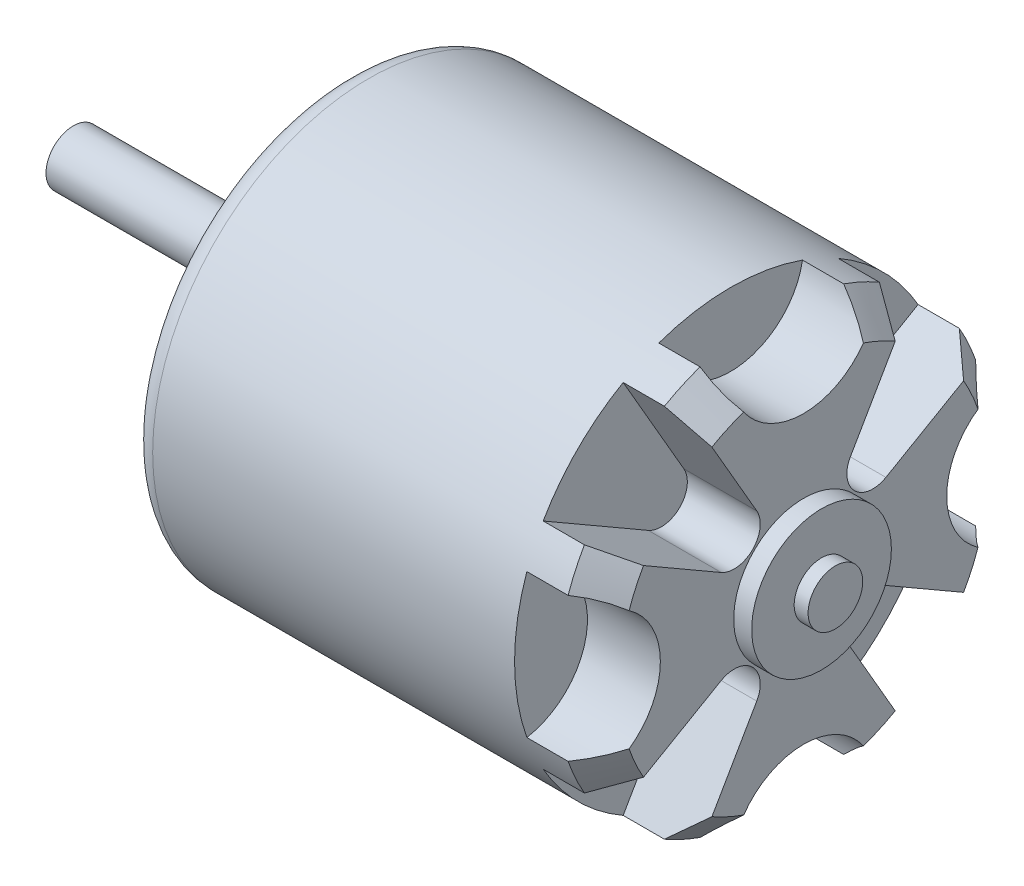
from build123d import *

# Parameters (mm, degrees)
SKETCH1_R                       = 31.623
BOSS_EXTRUDE1_DEPTH             = 66.802
CUT_EXTRUDE1_START              = -10.668
CUT_EXTRUDE1_DEPTH              = 10.668
CHAMFER1_SIZE                   = 4.6355
SKETCH3_R                       = 10.2235
BOSS_EXTRUDE2_DEPTH             = 2.6289
SKETCH4_R                       = 4
BOSS_EXTRUDE3_DEPTH             = 2.032
SKETCH5_R                       = 8.7376
BOSS_EXTRUDE4_DEPTH             = 12.3698
BOSS_EXTRUDE5_START             = 27.686
SKETCH6_R                       = 4
BOSS_EXTRUDE5_DEPTH             = 27.686
M4X0_7_TAPPED_HOLE1_D           = 3.3
M4X0_7_TAPPED_HOLE1_DEPTH       = 9.906
M4X0_7_TAPPED_HOLE1_CSINK_D     = 4.05
M4X0_7_TAPPED_HOLE1_CSINK_ANGLE = 90
M4X0_7_TAPPED_HOLE1_TIP         = 0.991420021
FILLET1_R                       = 3.175


with BuildPart() as part:
    # Sketch1 → Boss-Extrude1 (new body)
    with BuildSketch(Plane(origin=(0, 0, 0), x_dir=(0, 0, -1), z_dir=(1, 0, 0))):
        Circle(SKETCH1_R)
    extrude(amount=BOSS_EXTRUDE1_DEPTH)

    # Sketch2 → Cut-Extrude1 (cut)
    with BuildSketch(Plane(origin=(66.802, 0, 0), x_dir=(0, 0, -1), z_dir=(1, 0, 0)).offset(CUT_EXTRUDE1_START)):
        with BuildLine():
            Line((-27.43403991, 15.728559476), (-12.052689417, 6.848132628))
            ThreePointArc((-12.052689417, 6.848132628), (-7.45361258, 7.45361258), (-6.848132628, 12.052689417))
            Line((-6.848132628, 12.052689417), (-15.728559476, 27.43403991))
            ThreePointArc((-15.728559476, 27.43403991), (-22.360837741, 22.360837741), (-27.43403991, 15.728559476))
        make_face()
        with BuildLine():
            ThreePointArc((-29.823578313, -10.515146485), (-20.955, 0), (-29.823578313, 10.515146485))
            ThreePointArc((-29.823578313, 10.515146485), (-31.623, 0), (-29.823578313, -10.515146485))
        make_face()
        with BuildLine():
            ThreePointArc((6.848132628, 12.052689417), (7.45361258, 7.45361258), (12.052689417, 6.848132628))
            Line((12.052689417, 6.848132628), (27.43403991, 15.728559476))
            ThreePointArc((27.43403991, 15.728559476), (22.360837741, 22.360837741), (15.728559476, 27.43403991))
            Line((15.728559476, 27.43403991), (6.848132628, 12.052689417))
        make_face()
        with BuildLine():
            ThreePointArc((-6.848132628, -12.052689417), (-7.45361258, -7.45361258), (-12.052689417, -6.848132628))
            Line((-12.052689417, -6.848132628), (-27.43403991, -15.728559476))
            ThreePointArc((-27.43403991, -15.728559476), (-22.360837741, -22.360837741), (-15.728559476, -27.43403991))
            Line((-15.728559476, -27.43403991), (-6.848132628, -12.052689417))
        make_face()
        with BuildLine():
            ThreePointArc((10.515146485, 29.823578313), (0, 31.623), (-10.515146485, 29.823578313))
            ThreePointArc((-10.515146485, 29.823578313), (0, 20.955), (10.515146485, 29.823578313))
        make_face()
        with BuildLine():
            ThreePointArc((12.052689417, -6.848132628), (7.45361258, -7.45361258), (6.848132628, -12.052689417))
            Line((6.848132628, -12.052689417), (15.728559476, -27.43403991))
            ThreePointArc((15.728559476, -27.43403991), (22.360837741, -22.360837741), (27.43403991, -15.728559476))
            Line((27.43403991, -15.728559476), (12.052689417, -6.848132628))
        make_face()
        with BuildLine():
            ThreePointArc((29.823578313, -10.515146485), (31.623, 0), (29.823578313, 10.515146485))
            ThreePointArc((29.823578313, 10.515146485), (20.955, 0), (29.823578313, -10.515146485))
        make_face()
        with BuildLine():
            ThreePointArc((10.515146485, -29.823578313), (0, -20.955), (-10.515146485, -29.823578313))
            ThreePointArc((-10.515146485, -29.823578313), (0, -31.623), (10.515146485, -29.823578313))
        make_face()
    extrude(amount=CUT_EXTRUDE1_DEPTH, mode=Mode.SUBTRACT)

    # Chamfer1
    chamfer1_edges = [part.edges().sort_by_distance(p)[0] for p in [
        (66.802, 28.747236909, 13.176133693),
        (66.802, 28.747236909, -13.176133693),
        (66.802, 13.176133693, -28.747236909),
        (66.802, -13.176133693, -28.747236909),
        (66.802, -28.747236909, -13.176133693),
        (66.802, -28.747236909, 13.176133693),
        (66.802, -13.176133693, 28.747236909),
        (66.802, 13.176133693, 28.747236909),
    ]]
    chamfer(chamfer1_edges, length=CHAMFER1_SIZE)

    # Sketch3 → Boss-Extrude2 (add)
    with BuildSketch(Plane(origin=(66.802, 0, 0), x_dir=(0, 0, -1), z_dir=(1, 0, 0))):
        Circle(SKETCH3_R)
    extrude(amount=BOSS_EXTRUDE2_DEPTH)

    # Sketch4 → Boss-Extrude3 (add)
    with BuildSketch(Plane(origin=(69.4309, 0, 0), x_dir=(0, 0, -1), z_dir=(1, 0, 0))):
        Circle(SKETCH4_R)
    extrude(amount=BOSS_EXTRUDE3_DEPTH)

    # Sketch5 → Boss-Extrude4 (add)
    with BuildSketch(Plane.ZY):
        Circle(SKETCH5_R)
    extrude(amount=BOSS_EXTRUDE4_DEPTH)

    # Sketch6 → Boss-Extrude5 (add)
    with BuildSketch(Plane.ZY.offset(12.3698).offset(BOSS_EXTRUDE5_START)):
        Circle(SKETCH6_R)
    extrude(amount=-BOSS_EXTRUDE5_DEPTH)

    # M4x0.7 Tapped Hole1
    with Locations(Plane.ZY):
        with Locations((0, 22.05), (-22.05, 0), (0, -22.05), (22.05, 0)):
            CounterSinkHole(M4X0_7_TAPPED_HOLE1_D / 2, M4X0_7_TAPPED_HOLE1_CSINK_D / 2, depth=M4X0_7_TAPPED_HOLE1_DEPTH, counter_sink_angle=M4X0_7_TAPPED_HOLE1_CSINK_ANGLE)
            with Locations((0, 0, -(M4X0_7_TAPPED_HOLE1_DEPTH + M4X0_7_TAPPED_HOLE1_TIP / 2))):  # 118° drill point
                Cone(0, M4X0_7_TAPPED_HOLE1_D / 2, M4X0_7_TAPPED_HOLE1_TIP, mode=Mode.SUBTRACT)

    # Fillet1
    fillet1_edges = [part.edges().sort_by_distance(p)[0] for p in [
        (0, 0, 31.623),
    ]]
    fillet(fillet1_edges, radius=FILLET1_R)


solid = part.part
